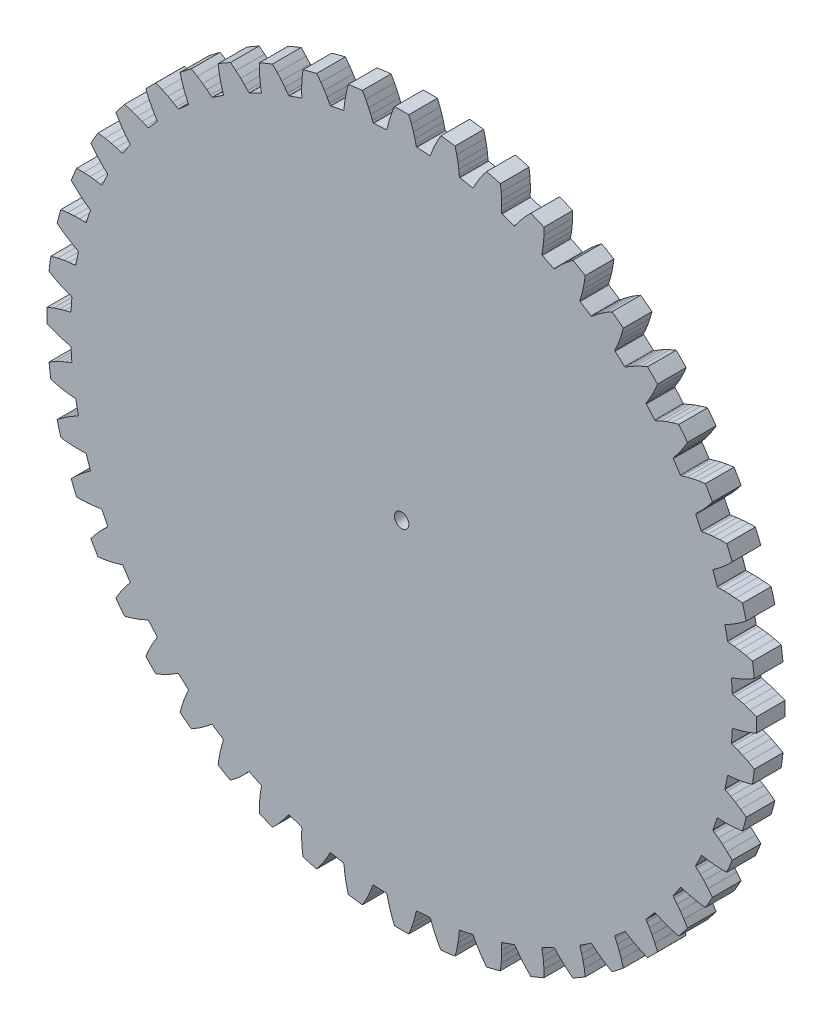
from build123d import *

# Parameters (mm, degrees)
BOSS_EXTRUDE1_DEPTH = 6.35
SKETCH2_R           = 1.5875
CUT_EXTRUDE1_DEPTH  = 112.344514528


with BuildPart() as part:
    # Model → Boss-Extrude1 (new body)
    with BuildSketch(Plane.XY):
        with BuildLine():
            ThreePointArc((73.162446932, -4.79532012), (73.204630323, -4.10132118), (73.240230779, -3.406953428))
            ThreePointArc((73.240230779, -3.406953428), (73.260031427, -3.342420246), (73.308462453, -3.295398625))
            ThreePointArc((73.308462453, -3.295398625), (73.487533932, -3.211262438), (73.677741354, -3.156795666))
            ThreePointArc((73.677741354, -3.156795666), (74.184998964, -3.047419574), (74.689081629, -2.92423646))
            ThreePointArc((74.689081629, -2.92423646), (75.251182782, -2.771398985), (75.809400918, -2.604937236))
            ThreePointArc((75.809400918, -2.604937236), (76.484121563, -2.384761597), (77.152671556, -2.14650508))
            ThreePointArc((77.152671556, -2.14650508), (77.874182007, -1.868186231), (78.588597242, -1.572129509))
            ThreePointArc((78.588597242, -1.572129509), (78.604320541, 0), (78.588597242, 1.572129509))
            ThreePointArc((78.588597242, 1.572129509), (77.874182033, 1.868186221), (77.152671609, 2.14650506))
            ThreePointArc((77.152671609, 2.14650506), (76.484121638, 2.384761571), (75.809401016, 2.604937206))
            ThreePointArc((75.809401016, 2.604937206), (75.251182893, 2.771398953), (74.689081753, 2.924236429))
            ThreePointArc((74.689081753, 2.924236429), (74.184999097, 3.047419543), (73.677741495, 3.156795638))
            ThreePointArc((73.677741495, 3.156795638), (73.48753402, 3.211262408), (73.308462484, 3.295398596))
            ThreePointArc((73.308462484, 3.295398596), (73.260031444, 3.342420218), (73.24023078, 3.406953405))
            ThreePointArc((73.24023078, 3.406953405), (73.162446933, 4.795320109), (73.058347109, 6.181961972))
            ThreePointArc((73.058347109, 6.181961972), (73.06955509, 6.248527566), (73.111434229, 6.301468429))
            ThreePointArc((73.111434229, 6.301468429), (73.277991751, 6.408258337), (73.459462581, 6.487086188))
            ThreePointArc((73.459462581, 6.487086188), (73.948104087, 6.661736958), (74.431795632, 6.849662213))
            ThreePointArc((74.431795632, 6.849662213), (74.969138639, 7.074561066), (75.500853523, 7.312460799))
            ThreePointArc((75.500853523, 7.312460799), (76.141063151, 7.618821522), (76.77279489, 7.942303006))
            ThreePointArc((76.77279489, 7.942303006), (77.451804819, 8.312416811), (78.121464977, 8.699190627))
            ThreePointArc((78.121464977, 8.699190627), (77.931849682, 10.259922652), (77.71105682, 11.816550073))
            ThreePointArc((77.71105682, 11.816550073), (76.964110376, 12.016824081), (76.212444676, 12.198585857))
            ThreePointArc((76.212444676, 12.198585857), (75.518515528, 12.347540768), (74.820828547, 12.477764056))
            ThreePointArc((74.820828547, 12.477764056), (74.245658439, 12.569939614), (73.668416858, 12.648100622))
            ThreePointArc((73.668416858, 12.648100622), (73.152568076, 12.704433898), (72.635373689, 12.746663862))
            ThreePointArc((72.635373689, 12.746663862), (72.439684125, 12.775837604), (72.251162595, 12.83588047))
            ThreePointArc((72.251162595, 12.83588047), (72.197008335, 12.876178295), (72.168953797, 12.937574888))
            ThreePointArc((72.168953797, 12.937574888), (71.910617183, 14.303911092), (71.626414865, 15.665102288))
            ThreePointArc((71.626414865, 15.665102288), (71.628838407, 15.73256134), (71.663449094, 15.790515611))
            ThreePointArc((71.663449094, 15.790515611), (71.814642814, 15.918132035), (71.984272037, 16.0199722))
            ThreePointArc((71.984272037, 16.0199722), (72.445936647, 16.256909323), (72.900960975, 16.506361267))
            ThreePointArc((72.900960975, 16.506361267), (73.404351747, 16.799473416), (73.900465591, 17.104740603))
            ThreePointArc((73.900465591, 17.104740603), (74.495210038, 17.492044493), (75.079314418, 17.895216086))
            ThreePointArc((75.079314418, 17.895216086), (75.704205778, 18.350792096), (76.317652787, 18.821665199))
            ThreePointArc((76.317652787, 18.821665199), (75.925943269, 20.344295183), (75.50385867, 21.858786189))
            ThreePointArc((75.50385867, 21.858786189), (74.737161453, 21.959850751), (73.968201684, 22.041945467))
            ThreePointArc((73.968201684, 22.041945467), (73.260766679, 22.099050119), (72.552050957, 22.137092904))
            ThreePointArc((72.552050957, 22.137092904), (71.969770185, 22.153405123), (71.387264927, 22.155552307))
            ThreePointArc((71.387264927, 22.155552307), (70.868476334, 22.144071867), (70.350194501, 22.118433134))
            ThreePointArc((70.350194501, 22.118433134), (70.15237115, 22.121814677), (69.957625281, 22.15673687))
            ThreePointArc((69.957625281, 22.15673687), (69.898674397, 22.189621393), (69.862846006, 22.246830877))
            ThreePointArc((69.862846006, 22.246830877), (69.428376836, 23.567758191), (68.968934805, 24.880208361))
            ThreePointArc((68.968934805, 24.880208361), (68.962532439, 24.947406627), (68.989282477, 25.009382692))
            ThreePointArc((68.989282477, 25.009382692), (69.122525427, 25.155642081), (69.27741064, 25.278752046))
            ThreePointArc((69.27741064, 25.278752046), (69.704199144, 25.573921462), (70.122770665, 25.880631904))
            ThreePointArc((70.122770665, 25.880631904), (70.583596046, 26.236942118), (71.035620203, 26.604353553))
            ThreePointArc((71.035620203, 26.604353553), (71.574723228, 27.065973732), (72.101206061, 27.541937057))
            ThreePointArc((72.101206061, 27.541937057), (72.661286786, 28.075180241), (73.208024398, 28.622095861))
            ThreePointArc((73.208024398, 28.622095861), (72.620922915, 30.080571183), (72.004768564, 31.527012414))
            ThreePointArc((72.004768564, 31.527012414), (71.231438976, 31.527138285), (70.458342254, 31.508161279))
            ThreePointArc((70.458342254, 31.508161279), (69.7495058, 31.472438595), (69.04188766, 31.417649954))
            ThreePointArc((69.04188766, 31.417649954), (68.462459208, 31.357819728), (67.8846571, 31.28391635))
            ThreePointArc((67.8846571, 31.28391635), (67.371805314, 31.204818627), (66.861303979, 31.111749883))
            ThreePointArc((66.861303979, 31.111749883), (66.664731655, 31.089281367), (66.467093604, 31.098485359))
            ThreePointArc((66.467093604, 31.098485359), (66.404354761, 31.123393916), (66.361365551, 31.175437421))
            ThreePointArc((66.361365551, 31.175437421), (65.758197711, 32.428354413), (65.131377147, 33.669607171))
            ThreePointArc((65.131377147, 33.669607171), (65.116258421, 33.73539487), (65.134690109, 33.800332302))
            ThreePointArc((65.134690109, 33.800332302), (65.247702466, 33.962732117), (65.385193539, 34.105005435))
            ThreePointArc((65.385193539, 34.105005435), (65.769803469, 34.453356715), (66.144760306, 34.812077753))
            ThreePointArc((66.144760306, 34.812077753), (66.555135447, 35.225489466), (66.955335659, 35.648758637))
            ThreePointArc((66.955335659, 35.648758637), (67.429573058, 36.176796657), (67.889426077, 36.717407849))
            ThreePointArc((67.889426077, 36.717407849), (68.375113032, 37.319194268), (68.845786414, 37.932794528))
            ThreePointArc((68.845786414, 37.932794528), (68.073338436, 39.302160271), (67.273656905, 40.655802714))
            ThreePointArc((67.273656905, 40.655802714), (66.506926829, 40.554987742), (65.742921053, 40.435263716))
            ThreePointArc((65.742921053, 40.435263716), (65.044811539, 40.307324922), (64.350398523, 40.160642303))
            ThreePointArc((64.350398523, 40.160642303), (63.783736574, 40.025693344), (63.220523969, 39.87700391))
            ThreePointArc((63.220523969, 39.87700391), (62.722384026, 39.731642289), (62.22839801, 39.572735965))
            ThreePointArc((62.22839801, 39.572735965), (62.036440119, 39.524801833), (61.839291526, 39.508130142))
            ThreePointArc((61.839291526, 39.508130142), (61.773838203, 39.52463654), (61.724423732, 39.570623588))
            ThreePointArc((61.724423732, 39.570623588), (60.962877593, 40.7340925), (60.179403569, 41.882909668))
            ThreePointArc((60.179403569, 41.882909668), (60.155827168, 41.946161154), (60.165625135, 42.012948855))
            ThreePointArc((60.165625135, 42.012948855), (60.256473226, 42.188710389), (60.37421765, 42.347712726))
            ThreePointArc((60.37421765, 42.347712726), (60.710068222, 42.743285482), (61.03499476, 43.1478793))
            ThreePointArc((61.03499476, 43.1478793), (61.387898028, 43.611318923), (61.729426758, 44.083203578))
            ThreePointArc((61.729426758, 44.083203578), (62.130684199, 44.668624561), (62.516039191, 45.264633613))
            ThreePointArc((62.516039191, 45.264633613), (62.919022137, 45.924666535), (63.305577938, 46.594452564))
            ThreePointArc((63.305577938, 46.594452564), (62.361000263, 47.851278499), (61.391474324, 49.088960959))
            ThreePointArc((61.391474324, 49.088960959), (60.644462725, 48.888930115), (59.902620245, 48.67050758))
            ThreePointArc((59.902620245, 48.67050758), (59.227182519, 48.452541743), (58.557856226, 48.216474928))
            ThreePointArc((58.557856226, 48.216474928), (58.013656522, 48.008716249), (57.474670145, 47.787784878))
            ThreePointArc((57.474670145, 47.787784878), (56.999765357, 47.578646535), (56.530746897, 47.356621563))
            ThreePointArc((56.530746897, 47.356621563), (56.346687892, 47.284041982), (56.153402025, 47.241779864))
            ThreePointArc((56.153402025, 47.241779864), (56.086354148, 47.249601675), (56.031359909, 47.288745415))
            ThreePointArc((56.031359909, 47.288745415), (55.124465736, 48.342858971), (54.197743711, 49.379583967))
            ThreePointArc((54.197743711, 49.379583967), (54.166113034, 49.43921699), (54.167109633, 49.506712205))
            ThreePointArc((54.167109633, 49.506712205), (54.234239023, 49.69282813), (54.330222157, 49.865838912))
            ThreePointArc((54.330222157, 49.865838912), (54.611566875, 50.301864784), (54.880903531, 50.745408669))
            ThreePointArc((54.880903531, 50.745408669), (55.170296653, 51.250946622), (55.447310251, 51.763372683))
            ThreePointArc((55.447310251, 51.763372683), (55.768722107, 52.396159914), (56.072985542, 53.037368946))
            ThreePointArc((56.072985542, 53.037368946), (56.386369329, 53.744355024), (56.682193471, 54.458866597))
            ThreePointArc((56.682193471, 54.458866597), (55.581648085, 55.581648085), (54.458866597, 56.682193471))
            ThreePointArc((54.458866597, 56.682193471), (53.74435505, 56.38636934), (53.037368997, 56.072985565))
            ThreePointArc((53.037368997, 56.072985565), (52.396159985, 55.768722142), (51.763372773, 55.447310299))
            ThreePointArc((51.763372773, 55.447310299), (51.250946723, 55.170296709), (50.74540878, 54.880903596))
            ThreePointArc((50.74540878, 54.880903596), (50.3018649, 54.611566948), (49.865839032, 54.330222236))
            ThreePointArc((49.865839032, 54.330222236), (49.692828213, 54.234239063), (49.506712247, 54.167109635))
            ThreePointArc((49.506712247, 54.167109635), (49.439217022, 54.166113025), (49.379583984, 54.197743696))
            ThreePointArc((49.379583984, 54.197743696), (48.342858988, 55.124465721), (47.288745432, 56.031359895))
            ThreePointArc((47.288745432, 56.031359895), (47.249601688, 56.086354117), (47.241779868, 56.153401983))
            ThreePointArc((47.241779868, 56.153401983), (47.284041953, 56.346687804), (47.3566215, 56.530746768))
            ThreePointArc((47.3566215, 56.530746768), (47.578646478, 56.999765233), (47.787784827, 57.474670027))
            ThreePointArc((47.787784827, 57.474670027), (48.008716207, 58.013656415), (48.216474893, 58.55785613))
            ThreePointArc((48.216474893, 58.55785613), (48.452541718, 59.227182444), (48.670507563, 59.902620192))
            ThreePointArc((48.670507563, 59.902620192), (48.888930108, 60.644462698), (49.088960959, 61.391474324))
            ThreePointArc((49.088960959, 61.391474324), (47.851278499, 62.361000263), (46.594452564, 63.305577938))
            ThreePointArc((46.594452564, 63.305577938), (45.924666559, 62.919022151), (45.264633661, 62.516039221))
            ThreePointArc((45.264633661, 62.516039221), (44.668624627, 62.130684243), (44.083203661, 61.729426817))
            ThreePointArc((44.083203661, 61.729426817), (43.611319016, 61.387898096), (43.147879401, 61.034994839))
            ThreePointArc((43.147879401, 61.034994839), (42.743285587, 60.710068309), (42.347712835, 60.374217744))
            ThreePointArc((42.347712835, 60.374217744), (42.188710466, 60.256473277), (42.012948897, 60.165625142))
            ThreePointArc((42.012948897, 60.165625142), (41.946161187, 60.155827164), (41.882909686, 60.179403556))
            ThreePointArc((41.882909686, 60.179403556), (40.734092519, 60.96287758), (39.570623607, 61.72442372))
            ThreePointArc((39.570623607, 61.72442372), (39.524636557, 61.773838175), (39.508130151, 61.839291485))
            ThreePointArc((39.508130151, 61.839291485), (39.524801816, 62.036440028), (39.572735919, 62.228397873))
            ThreePointArc((39.572735919, 62.228397873), (39.731642249, 62.722383896), (39.877003876, 63.220523846))
            ThreePointArc((39.877003876, 63.220523846), (40.025693316, 63.783736462), (40.160642281, 64.350398423))
            ThreePointArc((40.160642281, 64.350398423), (40.307324906, 65.044811462), (40.435263707, 65.742920997))
            ThreePointArc((40.435263707, 65.742920997), (40.554987738, 66.506926801), (40.655802714, 67.273656905))
            ThreePointArc((40.655802714, 67.273656905), (39.302160271, 68.073338436), (37.932794528, 68.845786414))
            ThreePointArc((37.932794528, 68.845786414), (37.31919429, 68.375113049), (36.717407893, 67.889426113))
            ThreePointArc((36.717407893, 67.889426113), (36.176796717, 67.42957311), (35.648758713, 66.955335728))
            ThreePointArc((35.648758713, 66.955335728), (35.225489549, 66.555135527), (34.812077843, 66.144760398))
            ThreePointArc((34.812077843, 66.144760398), (34.453356808, 65.769803569), (34.105005531, 65.385193648))
            ThreePointArc((34.105005531, 65.385193648), (33.962732186, 65.247702526), (33.800332343, 65.134690122))
            ThreePointArc((33.800332343, 65.134690122), (33.735394903, 65.116258421), (33.669607191, 65.131377137))
            ThreePointArc((33.669607191, 65.131377137), (32.428354433, 65.758197701), (31.175437442, 66.361365541))
            ThreePointArc((31.175437442, 66.361365541), (31.123393936, 66.404354734), (31.098485374, 66.467093564))
            ThreePointArc((31.098485374, 66.467093564), (31.089281362, 66.664731563), (31.111749855, 66.861303838))
            ThreePointArc((31.111749855, 66.861303838), (31.204818605, 67.37180518), (31.283916332, 67.884656973))
            ThreePointArc((31.283916332, 67.884656973), (31.357819715, 68.462459094), (31.417649945, 69.041887558))
            ThreePointArc((31.417649945, 69.041887558), (31.47243859, 69.749505721), (31.508161277, 70.458342198))
            ThreePointArc((31.508161277, 70.458342198), (31.527138285, 71.231438948), (31.527012414, 72.004768564))
            ThreePointArc((31.527012414, 72.004768564), (30.080571183, 72.620922915), (28.622095861, 73.208024398))
            ThreePointArc((28.622095861, 73.208024398), (28.075180261, 72.661286806), (27.541937096, 72.101206102))
            ThreePointArc((27.541937096, 72.101206102), (27.065973785, 71.574723287), (26.604353618, 71.035620282))
            ThreePointArc((26.604353618, 71.035620282), (26.23694219, 70.583596136), (25.880631981, 70.122770767))
            ThreePointArc((25.880631981, 70.122770767), (25.573921542, 69.704199255), (25.278752126, 69.277410759))
            ThreePointArc((25.278752126, 69.277410759), (25.155642143, 69.122525496), (25.009382731, 68.989282495))
            ThreePointArc((25.009382731, 68.989282495), (24.94740666, 68.962532443), (24.880208383, 68.968934797))
            ThreePointArc((24.880208383, 68.968934797), (23.567758212, 69.428376828), (22.246830898, 69.862846))
            ThreePointArc((22.246830898, 69.862846), (22.189621416, 69.898674374), (22.156736889, 69.957625244))
            ThreePointArc((22.156736889, 69.957625244), (22.121814683, 70.152371058), (22.118433125, 70.350194357))
            ThreePointArc((22.118433125, 70.350194357), (22.144071862, 70.868476198), (22.155552306, 71.387264799))
            ThreePointArc((22.155552306, 71.387264799), (22.153405125, 71.96977007), (22.137092908, 72.552050855))
            ThreePointArc((22.137092908, 72.552050855), (22.099050124, 73.2607666), (22.041945472, 73.968201628))
            ThreePointArc((22.041945472, 73.968201628), (21.959850754, 74.737161425), (21.858786189, 75.50385867))
            ThreePointArc((21.858786189, 75.50385867), (20.344295183, 75.925943269), (18.821665199, 76.317652787))
            ThreePointArc((18.821665199, 76.317652787), (18.350792113, 75.7042058), (17.895216119, 75.079314464))
            ThreePointArc((17.895216119, 75.079314464), (17.492044537, 74.495210104), (17.104740658, 73.900465677))
            ThreePointArc((17.104740658, 73.900465677), (16.799473475, 73.404351846), (16.50636133, 72.900961087))
            ThreePointArc((16.50636133, 72.900961087), (16.256909387, 72.445936767), (16.019972264, 71.984272166))
            ThreePointArc((16.019972264, 71.984272166), (15.918132087, 71.81464289), (15.790515647, 71.663449117))
            ThreePointArc((15.790515647, 71.663449117), (15.732561372, 71.628838415), (15.66510231, 71.626414861))
            ThreePointArc((15.66510231, 71.626414861), (14.303911114, 71.910617179), (12.93757491, 72.168953793))
            ThreePointArc((12.93757491, 72.168953793), (12.876178322, 72.197008315), (12.835880494, 72.25116256))
            ThreePointArc((12.835880494, 72.25116256), (12.775837623, 72.439684034), (12.746663872, 72.635373545))
            ThreePointArc((12.746663872, 72.635373545), (12.704433911, 73.152567941), (12.648100638, 73.668416731))
            ThreePointArc((12.648100638, 73.668416731), (12.569939631, 74.245658325), (12.477764073, 74.820828446))
            ThreePointArc((12.477764073, 74.820828446), (12.347540784, 75.51851545), (12.198585869, 76.212444621))
            ThreePointArc((12.198585869, 76.212444621), (12.016824088, 76.964110349), (11.816550073, 77.71105682))
            ThreePointArc((11.816550073, 77.71105682), (10.259922652, 77.931849682), (8.699190627, 78.121464977))
            ThreePointArc((8.699190627, 78.121464977), (8.312416824, 77.451804844), (7.942303033, 76.77279494))
            ThreePointArc((7.942303033, 76.77279494), (7.618821558, 76.141063222), (7.312460842, 75.500853616))
            ThreePointArc((7.312460842, 75.500853616), (7.074561112, 74.969138744), (6.849662261, 74.431795751))
            ThreePointArc((6.849662261, 74.431795751), (6.661737006, 73.948104214), (6.487086235, 73.459462718))
            ThreePointArc((6.487086235, 73.459462718), (6.408258378, 73.277991833), (6.301468462, 73.111434256))
            ThreePointArc((6.301468462, 73.111434256), (6.248527597, 73.069555103), (6.181961994, 73.058347108))
            ThreePointArc((6.181961994, 73.058347108), (4.795320131, 73.162446932), (3.406953428, 73.240230779))
            ThreePointArc((3.406953428, 73.240230779), (3.342420246, 73.260031427), (3.295398625, 73.308462453))
            ThreePointArc((3.295398625, 73.308462453), (3.211262438, 73.487533932), (3.156795666, 73.677741354))
            ThreePointArc((3.156795666, 73.677741354), (3.047419574, 74.184998964), (2.92423646, 74.689081629))
            ThreePointArc((2.92423646, 74.689081629), (2.771398985, 75.251182782), (2.604937236, 75.809400918))
            ThreePointArc((2.604937236, 75.809400918), (2.384761597, 76.484121563), (2.14650508, 77.152671556))
            ThreePointArc((2.14650508, 77.152671556), (1.868186231, 77.874182007), (1.572129509, 78.588597242))
            ThreePointArc((1.572129509, 78.588597242), (0, 78.604320541), (-1.572129509, 78.588597242))
            ThreePointArc((-1.572129509, 78.588597242), (-1.868186221, 77.874182033), (-2.14650506, 77.152671609))
            ThreePointArc((-2.14650506, 77.152671609), (-2.384761571, 76.484121638), (-2.604937206, 75.809401016))
            ThreePointArc((-2.604937206, 75.809401016), (-2.771398953, 75.251182893), (-2.924236429, 74.689081753))
            ThreePointArc((-2.924236429, 74.689081753), (-3.047419543, 74.184999097), (-3.156795638, 73.677741495))
            ThreePointArc((-3.156795638, 73.677741495), (-3.211262408, 73.48753402), (-3.295398596, 73.308462484))
            ThreePointArc((-3.295398596, 73.308462484), (-3.342420218, 73.260031444), (-3.406953405, 73.24023078))
            ThreePointArc((-3.406953405, 73.24023078), (-4.795320109, 73.162446933), (-6.181961972, 73.058347109))
            ThreePointArc((-6.181961972, 73.058347109), (-6.248527566, 73.06955509), (-6.301468429, 73.111434229))
            ThreePointArc((-6.301468429, 73.111434229), (-6.408258337, 73.277991751), (-6.487086188, 73.459462581))
            ThreePointArc((-6.487086188, 73.459462581), (-6.661736958, 73.948104087), (-6.849662213, 74.431795632))
            ThreePointArc((-6.849662213, 74.431795632), (-7.074561066, 74.969138639), (-7.312460799, 75.500853523))
            ThreePointArc((-7.312460799, 75.500853523), (-7.618821522, 76.141063151), (-7.942303006, 76.77279489))
            ThreePointArc((-7.942303006, 76.77279489), (-8.312416811, 77.451804819), (-8.699190627, 78.121464977))
            ThreePointArc((-8.699190627, 78.121464977), (-10.259922652, 77.931849682), (-11.816550073, 77.71105682))
            ThreePointArc((-11.816550073, 77.71105682), (-12.016824081, 76.964110376), (-12.198585857, 76.212444676))
            ThreePointArc((-12.198585857, 76.212444676), (-12.347540768, 75.518515528), (-12.477764056, 74.820828547))
            ThreePointArc((-12.477764056, 74.820828547), (-12.569939614, 74.245658439), (-12.648100622, 73.668416858))
            ThreePointArc((-12.648100622, 73.668416858), (-12.704433898, 73.152568076), (-12.746663862, 72.635373689))
            ThreePointArc((-12.746663862, 72.635373689), (-12.775837604, 72.439684125), (-12.83588047, 72.251162595))
            ThreePointArc((-12.83588047, 72.251162595), (-12.876178295, 72.197008335), (-12.937574888, 72.168953797))
            ThreePointArc((-12.937574888, 72.168953797), (-14.303911092, 71.910617183), (-15.665102288, 71.626414865))
            ThreePointArc((-15.665102288, 71.626414865), (-15.73256134, 71.628838407), (-15.790515611, 71.663449094))
            ThreePointArc((-15.790515611, 71.663449094), (-15.918132035, 71.814642814), (-16.0199722, 71.984272037))
            ThreePointArc((-16.0199722, 71.984272037), (-16.256909323, 72.445936647), (-16.506361267, 72.900960975))
            ThreePointArc((-16.506361267, 72.900960975), (-16.799473416, 73.404351747), (-17.104740603, 73.900465591))
            ThreePointArc((-17.104740603, 73.900465591), (-17.492044493, 74.495210038), (-17.895216086, 75.079314418))
            ThreePointArc((-17.895216086, 75.079314418), (-18.350792096, 75.704205778), (-18.821665199, 76.317652787))
            ThreePointArc((-18.821665199, 76.317652787), (-20.344295183, 75.925943269), (-21.858786189, 75.50385867))
            ThreePointArc((-21.858786189, 75.50385867), (-21.959850751, 74.737161453), (-22.041945467, 73.968201684))
            ThreePointArc((-22.041945467, 73.968201684), (-22.099050119, 73.260766679), (-22.137092904, 72.552050957))
            ThreePointArc((-22.137092904, 72.552050957), (-22.153405123, 71.969770185), (-22.155552307, 71.387264927))
            ThreePointArc((-22.155552307, 71.387264927), (-22.144071867, 70.868476334), (-22.118433134, 70.350194501))
            ThreePointArc((-22.118433134, 70.350194501), (-22.121814677, 70.15237115), (-22.15673687, 69.957625281))
            ThreePointArc((-22.15673687, 69.957625281), (-22.189621393, 69.898674397), (-22.246830877, 69.862846006))
            ThreePointArc((-22.246830877, 69.862846006), (-23.567758191, 69.428376836), (-24.880208361, 68.968934805))
            ThreePointArc((-24.880208361, 68.968934805), (-24.947406627, 68.962532439), (-25.009382692, 68.989282477))
            ThreePointArc((-25.009382692, 68.989282477), (-25.155642081, 69.122525427), (-25.278752046, 69.27741064))
            ThreePointArc((-25.278752046, 69.27741064), (-25.573921462, 69.704199144), (-25.880631904, 70.122770665))
            ThreePointArc((-25.880631904, 70.122770665), (-26.236942118, 70.583596046), (-26.604353553, 71.035620203))
            ThreePointArc((-26.604353553, 71.035620203), (-27.065973732, 71.574723228), (-27.541937057, 72.101206061))
            ThreePointArc((-27.541937057, 72.101206061), (-28.075180241, 72.661286786), (-28.622095861, 73.208024398))
            ThreePointArc((-28.622095861, 73.208024398), (-30.080571183, 72.620922915), (-31.527012414, 72.004768564))
            ThreePointArc((-31.527012414, 72.004768564), (-31.527138285, 71.231438976), (-31.508161279, 70.458342254))
            ThreePointArc((-31.508161279, 70.458342254), (-31.472438595, 69.7495058), (-31.417649954, 69.04188766))
            ThreePointArc((-31.417649954, 69.04188766), (-31.357819728, 68.462459208), (-31.28391635, 67.8846571))
            ThreePointArc((-31.28391635, 67.8846571), (-31.204818627, 67.371805314), (-31.111749883, 66.861303979))
            ThreePointArc((-31.111749883, 66.861303979), (-31.089281367, 66.664731655), (-31.098485359, 66.467093604))
            ThreePointArc((-31.098485359, 66.467093604), (-31.123393916, 66.404354761), (-31.175437421, 66.361365551))
            ThreePointArc((-31.175437421, 66.361365551), (-32.428354413, 65.758197711), (-33.669607171, 65.131377147))
            ThreePointArc((-33.669607171, 65.131377147), (-33.73539487, 65.116258421), (-33.800332302, 65.134690109))
            ThreePointArc((-33.800332302, 65.134690109), (-33.962732117, 65.247702466), (-34.105005435, 65.385193539))
            ThreePointArc((-34.105005435, 65.385193539), (-34.453356715, 65.769803469), (-34.812077753, 66.144760306))
            ThreePointArc((-34.812077753, 66.144760306), (-35.225489466, 66.555135447), (-35.648758637, 66.955335659))
            ThreePointArc((-35.648758637, 66.955335659), (-36.176796657, 67.429573058), (-36.717407849, 67.889426077))
            ThreePointArc((-36.717407849, 67.889426077), (-37.319194268, 68.375113032), (-37.932794528, 68.845786414))
            ThreePointArc((-37.932794528, 68.845786414), (-39.302160271, 68.073338436), (-40.655802714, 67.273656905))
            ThreePointArc((-40.655802714, 67.273656905), (-40.554987742, 66.506926829), (-40.435263716, 65.742921053))
            ThreePointArc((-40.435263716, 65.742921053), (-40.307324922, 65.044811539), (-40.160642303, 64.350398523))
            ThreePointArc((-40.160642303, 64.350398523), (-40.025693344, 63.783736574), (-39.87700391, 63.220523969))
            ThreePointArc((-39.87700391, 63.220523969), (-39.731642289, 62.722384026), (-39.572735965, 62.22839801))
            ThreePointArc((-39.572735965, 62.22839801), (-39.524801833, 62.036440119), (-39.508130142, 61.839291526))
            ThreePointArc((-39.508130142, 61.839291526), (-39.52463654, 61.773838203), (-39.570623588, 61.724423732))
            ThreePointArc((-39.570623588, 61.724423732), (-40.7340925, 60.962877593), (-41.882909668, 60.179403569))
            ThreePointArc((-41.882909668, 60.179403569), (-41.946161154, 60.155827168), (-42.012948855, 60.165625135))
            ThreePointArc((-42.012948855, 60.165625135), (-42.188710389, 60.256473226), (-42.347712726, 60.37421765))
            ThreePointArc((-42.347712726, 60.37421765), (-42.743285482, 60.710068222), (-43.1478793, 61.03499476))
            ThreePointArc((-43.1478793, 61.03499476), (-43.611318923, 61.387898028), (-44.083203578, 61.729426758))
            ThreePointArc((-44.083203578, 61.729426758), (-44.668624561, 62.130684199), (-45.264633613, 62.516039191))
            ThreePointArc((-45.264633613, 62.516039191), (-45.924666535, 62.919022137), (-46.594452564, 63.305577938))
            ThreePointArc((-46.594452564, 63.305577938), (-47.851278499, 62.361000263), (-49.088960959, 61.391474324))
            ThreePointArc((-49.088960959, 61.391474324), (-48.888930115, 60.644462725), (-48.67050758, 59.902620245))
            ThreePointArc((-48.67050758, 59.902620245), (-48.452541743, 59.227182519), (-48.216474928, 58.557856226))
            ThreePointArc((-48.216474928, 58.557856226), (-48.008716249, 58.013656522), (-47.787784878, 57.474670145))
            ThreePointArc((-47.787784878, 57.474670145), (-47.578646535, 56.999765357), (-47.356621563, 56.530746897))
            ThreePointArc((-47.356621563, 56.530746897), (-47.284041982, 56.346687892), (-47.241779864, 56.153402025))
            ThreePointArc((-47.241779864, 56.153402025), (-47.249601675, 56.086354148), (-47.288745415, 56.031359909))
            ThreePointArc((-47.288745415, 56.031359909), (-48.342858971, 55.124465736), (-49.379583967, 54.197743711))
            ThreePointArc((-49.379583967, 54.197743711), (-49.43921699, 54.166113034), (-49.506712205, 54.167109633))
            ThreePointArc((-49.506712205, 54.167109633), (-49.69282813, 54.234239023), (-49.865838912, 54.330222157))
            ThreePointArc((-49.865838912, 54.330222157), (-50.301864784, 54.611566875), (-50.745408669, 54.880903531))
            ThreePointArc((-50.745408669, 54.880903531), (-51.250946622, 55.170296653), (-51.763372683, 55.447310251))
            ThreePointArc((-51.763372683, 55.447310251), (-52.396159914, 55.768722107), (-53.037368946, 56.072985542))
            ThreePointArc((-53.037368946, 56.072985542), (-53.744355024, 56.386369329), (-54.458866597, 56.682193471))
            ThreePointArc((-54.458866597, 56.682193471), (-55.581648085, 55.581648085), (-56.682193471, 54.458866597))
            ThreePointArc((-56.682193471, 54.458866597), (-56.38636934, 53.74435505), (-56.072985565, 53.037368997))
            ThreePointArc((-56.072985565, 53.037368997), (-55.768722142, 52.396159985), (-55.447310299, 51.763372773))
            ThreePointArc((-55.447310299, 51.763372773), (-55.170296709, 51.250946723), (-54.880903596, 50.74540878))
            ThreePointArc((-54.880903596, 50.74540878), (-54.611566948, 50.3018649), (-54.330222236, 49.865839032))
            ThreePointArc((-54.330222236, 49.865839032), (-54.234239063, 49.692828213), (-54.167109635, 49.506712247))
            ThreePointArc((-54.167109635, 49.506712247), (-54.166113025, 49.439217022), (-54.197743696, 49.379583984))
            ThreePointArc((-54.197743696, 49.379583984), (-55.124465721, 48.342858988), (-56.031359895, 47.288745432))
            ThreePointArc((-56.031359895, 47.288745432), (-56.086354117, 47.249601688), (-56.153401983, 47.241779868))
            ThreePointArc((-56.153401983, 47.241779868), (-56.346687804, 47.284041953), (-56.530746768, 47.3566215))
            ThreePointArc((-56.530746768, 47.3566215), (-56.999765233, 47.578646478), (-57.474670027, 47.787784827))
            ThreePointArc((-57.474670027, 47.787784827), (-58.013656415, 48.008716207), (-58.55785613, 48.216474893))
            ThreePointArc((-58.55785613, 48.216474893), (-59.227182444, 48.452541718), (-59.902620192, 48.670507563))
            ThreePointArc((-59.902620192, 48.670507563), (-60.644462698, 48.888930108), (-61.391474324, 49.088960959))
            ThreePointArc((-61.391474324, 49.088960959), (-62.361000263, 47.851278499), (-63.305577938, 46.594452564))
            ThreePointArc((-63.305577938, 46.594452564), (-62.919022151, 45.924666559), (-62.516039221, 45.264633661))
            ThreePointArc((-62.516039221, 45.264633661), (-62.130684243, 44.668624627), (-61.729426817, 44.083203661))
            ThreePointArc((-61.729426817, 44.083203661), (-61.387898096, 43.611319016), (-61.034994839, 43.147879401))
            ThreePointArc((-61.034994839, 43.147879401), (-60.710068309, 42.743285587), (-60.374217744, 42.347712835))
            ThreePointArc((-60.374217744, 42.347712835), (-60.256473277, 42.188710466), (-60.165625142, 42.012948897))
            ThreePointArc((-60.165625142, 42.012948897), (-60.155827164, 41.946161187), (-60.179403556, 41.882909686))
            ThreePointArc((-60.179403556, 41.882909686), (-60.96287758, 40.734092519), (-61.72442372, 39.570623607))
            ThreePointArc((-61.72442372, 39.570623607), (-61.773838175, 39.524636557), (-61.839291485, 39.508130151))
            ThreePointArc((-61.839291485, 39.508130151), (-62.036440028, 39.524801816), (-62.228397873, 39.572735919))
            ThreePointArc((-62.228397873, 39.572735919), (-62.722383896, 39.731642249), (-63.220523846, 39.877003876))
            ThreePointArc((-63.220523846, 39.877003876), (-63.783736462, 40.025693316), (-64.350398423, 40.160642281))
            ThreePointArc((-64.350398423, 40.160642281), (-65.044811462, 40.307324906), (-65.742920997, 40.435263707))
            ThreePointArc((-65.742920997, 40.435263707), (-66.506926801, 40.554987738), (-67.273656905, 40.655802714))
            ThreePointArc((-67.273656905, 40.655802714), (-68.073338436, 39.302160271), (-68.845786414, 37.932794528))
            ThreePointArc((-68.845786414, 37.932794528), (-68.375113049, 37.31919429), (-67.889426113, 36.717407893))
            ThreePointArc((-67.889426113, 36.717407893), (-67.42957311, 36.176796717), (-66.955335728, 35.648758713))
            ThreePointArc((-66.955335728, 35.648758713), (-66.555135527, 35.225489549), (-66.144760398, 34.812077843))
            ThreePointArc((-66.144760398, 34.812077843), (-65.769803569, 34.453356808), (-65.385193648, 34.105005531))
            ThreePointArc((-65.385193648, 34.105005531), (-65.247702526, 33.962732186), (-65.134690122, 33.800332343))
            ThreePointArc((-65.134690122, 33.800332343), (-65.116258421, 33.735394903), (-65.131377137, 33.669607191))
            ThreePointArc((-65.131377137, 33.669607191), (-65.758197701, 32.428354433), (-66.361365541, 31.175437442))
            ThreePointArc((-66.361365541, 31.175437442), (-66.404354734, 31.123393936), (-66.467093564, 31.098485374))
            ThreePointArc((-66.467093564, 31.098485374), (-66.664731563, 31.089281362), (-66.861303838, 31.111749855))
            ThreePointArc((-66.861303838, 31.111749855), (-67.37180518, 31.204818605), (-67.884656973, 31.283916332))
            ThreePointArc((-67.884656973, 31.283916332), (-68.462459094, 31.357819715), (-69.041887558, 31.417649945))
            ThreePointArc((-69.041887558, 31.417649945), (-69.749505721, 31.47243859), (-70.458342198, 31.508161277))
            ThreePointArc((-70.458342198, 31.508161277), (-71.231438948, 31.527138285), (-72.004768564, 31.527012414))
            ThreePointArc((-72.004768564, 31.527012414), (-72.620922915, 30.080571183), (-73.208024398, 28.622095861))
            ThreePointArc((-73.208024398, 28.622095861), (-72.661286806, 28.075180261), (-72.101206102, 27.541937096))
            ThreePointArc((-72.101206102, 27.541937096), (-71.574723287, 27.065973785), (-71.035620282, 26.604353618))
            ThreePointArc((-71.035620282, 26.604353618), (-70.583596136, 26.23694219), (-70.122770767, 25.880631981))
            ThreePointArc((-70.122770767, 25.880631981), (-69.704199255, 25.573921542), (-69.277410759, 25.278752126))
            ThreePointArc((-69.277410759, 25.278752126), (-69.122525496, 25.155642143), (-68.989282495, 25.009382731))
            ThreePointArc((-68.989282495, 25.009382731), (-68.962532443, 24.94740666), (-68.968934797, 24.880208383))
            ThreePointArc((-68.968934797, 24.880208383), (-69.428376828, 23.567758212), (-69.862846, 22.246830898))
            ThreePointArc((-69.862846, 22.246830898), (-69.898674374, 22.189621416), (-69.957625244, 22.156736889))
            ThreePointArc((-69.957625244, 22.156736889), (-70.152371058, 22.121814683), (-70.350194357, 22.118433125))
            ThreePointArc((-70.350194357, 22.118433125), (-70.868476198, 22.144071862), (-71.387264799, 22.155552306))
            ThreePointArc((-71.387264799, 22.155552306), (-71.96977007, 22.153405125), (-72.552050855, 22.137092908))
            ThreePointArc((-72.552050855, 22.137092908), (-73.2607666, 22.099050124), (-73.968201628, 22.041945472))
            ThreePointArc((-73.968201628, 22.041945472), (-74.737161425, 21.959850754), (-75.50385867, 21.858786189))
            ThreePointArc((-75.50385867, 21.858786189), (-75.925943269, 20.344295183), (-76.317652787, 18.821665199))
            ThreePointArc((-76.317652787, 18.821665199), (-75.7042058, 18.350792113), (-75.079314464, 17.895216119))
            ThreePointArc((-75.079314464, 17.895216119), (-74.495210104, 17.492044537), (-73.900465677, 17.104740658))
            ThreePointArc((-73.900465677, 17.104740658), (-73.404351846, 16.799473475), (-72.900961087, 16.50636133))
            ThreePointArc((-72.900961087, 16.50636133), (-72.445936767, 16.256909387), (-71.984272166, 16.019972264))
            ThreePointArc((-71.984272166, 16.019972264), (-71.81464289, 15.918132087), (-71.663449117, 15.790515647))
            ThreePointArc((-71.663449117, 15.790515647), (-71.628838415, 15.732561372), (-71.626414861, 15.66510231))
            ThreePointArc((-71.626414861, 15.66510231), (-71.910617179, 14.303911114), (-72.168953793, 12.93757491))
            ThreePointArc((-72.168953793, 12.93757491), (-72.197008315, 12.876178322), (-72.25116256, 12.835880494))
            ThreePointArc((-72.25116256, 12.835880494), (-72.439684034, 12.775837623), (-72.635373545, 12.746663872))
            ThreePointArc((-72.635373545, 12.746663872), (-73.152567941, 12.704433911), (-73.668416731, 12.648100638))
            ThreePointArc((-73.668416731, 12.648100638), (-74.245658325, 12.569939631), (-74.820828446, 12.477764073))
            ThreePointArc((-74.820828446, 12.477764073), (-75.51851545, 12.347540784), (-76.212444621, 12.198585869))
            ThreePointArc((-76.212444621, 12.198585869), (-76.964110349, 12.016824088), (-77.71105682, 11.816550073))
            ThreePointArc((-77.71105682, 11.816550073), (-77.931849682, 10.259922652), (-78.121464977, 8.699190627))
            ThreePointArc((-78.121464977, 8.699190627), (-77.451804844, 8.312416824), (-76.77279494, 7.942303033))
            ThreePointArc((-76.77279494, 7.942303033), (-76.141063222, 7.618821558), (-75.500853616, 7.312460842))
            ThreePointArc((-75.500853616, 7.312460842), (-74.969138744, 7.074561112), (-74.431795751, 6.849662261))
            ThreePointArc((-74.431795751, 6.849662261), (-73.948104214, 6.661737006), (-73.459462718, 6.487086235))
            ThreePointArc((-73.459462718, 6.487086235), (-73.277991833, 6.408258378), (-73.111434256, 6.301468462))
            ThreePointArc((-73.111434256, 6.301468462), (-73.069555103, 6.248527597), (-73.058347108, 6.181961994))
            ThreePointArc((-73.058347108, 6.181961994), (-73.162446932, 4.795320131), (-73.240230779, 3.406953428))
            ThreePointArc((-73.240230779, 3.406953428), (-73.260031427, 3.342420246), (-73.308462453, 3.295398625))
            ThreePointArc((-73.308462453, 3.295398625), (-73.487533932, 3.211262438), (-73.677741354, 3.156795666))
            ThreePointArc((-73.677741354, 3.156795666), (-74.184998964, 3.047419574), (-74.689081629, 2.92423646))
            ThreePointArc((-74.689081629, 2.92423646), (-75.251182782, 2.771398985), (-75.809400918, 2.604937236))
            ThreePointArc((-75.809400918, 2.604937236), (-76.484121563, 2.384761597), (-77.152671556, 2.14650508))
            ThreePointArc((-77.152671556, 2.14650508), (-77.874182007, 1.868186231), (-78.588597242, 1.572129509))
            ThreePointArc((-78.588597242, 1.572129509), (-78.604320541, 0), (-78.588597242, -1.572129509))
            ThreePointArc((-78.588597242, -1.572129509), (-77.874182033, -1.868186221), (-77.152671609, -2.14650506))
            ThreePointArc((-77.152671609, -2.14650506), (-76.484121638, -2.384761571), (-75.809401016, -2.604937206))
            ThreePointArc((-75.809401016, -2.604937206), (-75.251182893, -2.771398953), (-74.689081753, -2.924236429))
            ThreePointArc((-74.689081753, -2.924236429), (-74.184999097, -3.047419543), (-73.677741495, -3.156795638))
            ThreePointArc((-73.677741495, -3.156795638), (-73.48753402, -3.211262408), (-73.308462484, -3.295398596))
            ThreePointArc((-73.308462484, -3.295398596), (-73.260031444, -3.342420218), (-73.24023078, -3.406953405))
            ThreePointArc((-73.24023078, -3.406953405), (-73.162446933, -4.795320109), (-73.058347109, -6.181961972))
            ThreePointArc((-73.058347109, -6.181961972), (-73.06955509, -6.248527566), (-73.111434229, -6.301468429))
            ThreePointArc((-73.111434229, -6.301468429), (-73.277991751, -6.408258337), (-73.459462581, -6.487086188))
            ThreePointArc((-73.459462581, -6.487086188), (-73.948104087, -6.661736958), (-74.431795632, -6.849662213))
            ThreePointArc((-74.431795632, -6.849662213), (-74.969138639, -7.074561066), (-75.500853523, -7.312460799))
            ThreePointArc((-75.500853523, -7.312460799), (-76.141063151, -7.618821522), (-76.77279489, -7.942303006))
            ThreePointArc((-76.77279489, -7.942303006), (-77.451804819, -8.312416811), (-78.121464977, -8.699190627))
            ThreePointArc((-78.121464977, -8.699190627), (-77.931849682, -10.259922652), (-77.71105682, -11.816550073))
            ThreePointArc((-77.71105682, -11.816550073), (-76.964110376, -12.016824081), (-76.212444676, -12.198585857))
            ThreePointArc((-76.212444676, -12.198585857), (-75.518515528, -12.347540768), (-74.820828547, -12.477764056))
            ThreePointArc((-74.820828547, -12.477764056), (-74.245658439, -12.569939614), (-73.668416858, -12.648100622))
            ThreePointArc((-73.668416858, -12.648100622), (-73.152568076, -12.704433898), (-72.635373689, -12.746663862))
            ThreePointArc((-72.635373689, -12.746663862), (-72.439684125, -12.775837604), (-72.251162595, -12.83588047))
            ThreePointArc((-72.251162595, -12.83588047), (-72.197008335, -12.876178295), (-72.168953797, -12.937574888))
            ThreePointArc((-72.168953797, -12.937574888), (-71.910617183, -14.303911092), (-71.626414865, -15.665102288))
            ThreePointArc((-71.626414865, -15.665102288), (-71.628838407, -15.73256134), (-71.663449094, -15.790515611))
            ThreePointArc((-71.663449094, -15.790515611), (-71.814642814, -15.918132035), (-71.984272037, -16.0199722))
            ThreePointArc((-71.984272037, -16.0199722), (-72.445936647, -16.256909323), (-72.900960975, -16.506361267))
            ThreePointArc((-72.900960975, -16.506361267), (-73.404351747, -16.799473416), (-73.900465591, -17.104740603))
            ThreePointArc((-73.900465591, -17.104740603), (-74.495210038, -17.492044493), (-75.079314418, -17.895216086))
            ThreePointArc((-75.079314418, -17.895216086), (-75.704205778, -18.350792096), (-76.317652787, -18.821665199))
            ThreePointArc((-76.317652787, -18.821665199), (-75.925943269, -20.344295183), (-75.50385867, -21.858786189))
            ThreePointArc((-75.50385867, -21.858786189), (-74.737161453, -21.959850751), (-73.968201684, -22.041945467))
            ThreePointArc((-73.968201684, -22.041945467), (-73.260766679, -22.099050119), (-72.552050957, -22.137092904))
            ThreePointArc((-72.552050957, -22.137092904), (-71.969770185, -22.153405123), (-71.387264927, -22.155552307))
            ThreePointArc((-71.387264927, -22.155552307), (-70.868476334, -22.144071867), (-70.350194501, -22.118433134))
            ThreePointArc((-70.350194501, -22.118433134), (-70.15237115, -22.121814677), (-69.957625281, -22.15673687))
            ThreePointArc((-69.957625281, -22.15673687), (-69.898674397, -22.189621393), (-69.862846006, -22.246830877))
            ThreePointArc((-69.862846006, -22.246830877), (-69.428376836, -23.567758191), (-68.968934805, -24.880208361))
            ThreePointArc((-68.968934805, -24.880208361), (-68.962532439, -24.947406627), (-68.989282477, -25.009382692))
            ThreePointArc((-68.989282477, -25.009382692), (-69.122525427, -25.155642081), (-69.27741064, -25.278752046))
            ThreePointArc((-69.27741064, -25.278752046), (-69.704199144, -25.573921462), (-70.122770665, -25.880631904))
            ThreePointArc((-70.122770665, -25.880631904), (-70.583596046, -26.236942118), (-71.035620203, -26.604353553))
            ThreePointArc((-71.035620203, -26.604353553), (-71.574723228, -27.065973732), (-72.101206061, -27.541937057))
            ThreePointArc((-72.101206061, -27.541937057), (-72.661286786, -28.075180241), (-73.208024398, -28.622095861))
            ThreePointArc((-73.208024398, -28.622095861), (-72.620922915, -30.080571183), (-72.004768564, -31.527012414))
            ThreePointArc((-72.004768564, -31.527012414), (-71.231438976, -31.527138285), (-70.458342254, -31.508161279))
            ThreePointArc((-70.458342254, -31.508161279), (-69.7495058, -31.472438595), (-69.04188766, -31.417649954))
            ThreePointArc((-69.04188766, -31.417649954), (-68.462459208, -31.357819728), (-67.8846571, -31.28391635))
            ThreePointArc((-67.8846571, -31.28391635), (-67.371805314, -31.204818627), (-66.861303979, -31.111749883))
            ThreePointArc((-66.861303979, -31.111749883), (-66.664731655, -31.089281367), (-66.467093604, -31.098485359))
            ThreePointArc((-66.467093604, -31.098485359), (-66.404354761, -31.123393916), (-66.361365551, -31.175437421))
            ThreePointArc((-66.361365551, -31.175437421), (-65.758197711, -32.428354413), (-65.131377147, -33.669607171))
            ThreePointArc((-65.131377147, -33.669607171), (-65.116258421, -33.73539487), (-65.134690109, -33.800332302))
            ThreePointArc((-65.134690109, -33.800332302), (-65.247702466, -33.962732117), (-65.385193539, -34.105005435))
            ThreePointArc((-65.385193539, -34.105005435), (-65.769803469, -34.453356715), (-66.144760306, -34.812077753))
            ThreePointArc((-66.144760306, -34.812077753), (-66.555135447, -35.225489466), (-66.955335659, -35.648758637))
            ThreePointArc((-66.955335659, -35.648758637), (-67.429573058, -36.176796657), (-67.889426077, -36.717407849))
            ThreePointArc((-67.889426077, -36.717407849), (-68.375113032, -37.319194268), (-68.845786414, -37.932794528))
            ThreePointArc((-68.845786414, -37.932794528), (-68.073338436, -39.302160271), (-67.273656905, -40.655802714))
            ThreePointArc((-67.273656905, -40.655802714), (-66.506926829, -40.554987742), (-65.742921053, -40.435263716))
            ThreePointArc((-65.742921053, -40.435263716), (-65.044811539, -40.307324922), (-64.350398523, -40.160642303))
            ThreePointArc((-64.350398523, -40.160642303), (-63.783736574, -40.025693344), (-63.220523969, -39.87700391))
            ThreePointArc((-63.220523969, -39.87700391), (-62.722384026, -39.731642289), (-62.22839801, -39.572735965))
            ThreePointArc((-62.22839801, -39.572735965), (-62.036440119, -39.524801833), (-61.839291526, -39.508130142))
            ThreePointArc((-61.839291526, -39.508130142), (-61.773838203, -39.52463654), (-61.724423732, -39.570623588))
            ThreePointArc((-61.724423732, -39.570623588), (-60.962877593, -40.7340925), (-60.179403569, -41.882909668))
            ThreePointArc((-60.179403569, -41.882909668), (-60.155827168, -41.946161154), (-60.165625135, -42.012948855))
            ThreePointArc((-60.165625135, -42.012948855), (-60.256473226, -42.188710389), (-60.37421765, -42.347712726))
            ThreePointArc((-60.37421765, -42.347712726), (-60.710068222, -42.743285482), (-61.03499476, -43.1478793))
            ThreePointArc((-61.03499476, -43.1478793), (-61.387898028, -43.611318923), (-61.729426758, -44.083203578))
            ThreePointArc((-61.729426758, -44.083203578), (-62.130684199, -44.668624561), (-62.516039191, -45.264633613))
            ThreePointArc((-62.516039191, -45.264633613), (-62.919022137, -45.924666535), (-63.305577938, -46.594452564))
            ThreePointArc((-63.305577938, -46.594452564), (-62.361000263, -47.851278499), (-61.391474324, -49.088960959))
            ThreePointArc((-61.391474324, -49.088960959), (-60.644462725, -48.888930115), (-59.902620245, -48.67050758))
            ThreePointArc((-59.902620245, -48.67050758), (-59.227182519, -48.452541743), (-58.557856226, -48.216474928))
            ThreePointArc((-58.557856226, -48.216474928), (-58.013656522, -48.008716249), (-57.474670145, -47.787784878))
            ThreePointArc((-57.474670145, -47.787784878), (-56.999765357, -47.578646535), (-56.530746897, -47.356621563))
            ThreePointArc((-56.530746897, -47.356621563), (-56.346687892, -47.284041982), (-56.153402025, -47.241779864))
            ThreePointArc((-56.153402025, -47.241779864), (-56.086354148, -47.249601675), (-56.031359909, -47.288745415))
            ThreePointArc((-56.031359909, -47.288745415), (-55.124465736, -48.342858971), (-54.197743711, -49.379583967))
            ThreePointArc((-54.197743711, -49.379583967), (-54.166113034, -49.43921699), (-54.167109633, -49.506712205))
            ThreePointArc((-54.167109633, -49.506712205), (-54.234239023, -49.69282813), (-54.330222157, -49.865838912))
            ThreePointArc((-54.330222157, -49.865838912), (-54.611566875, -50.301864784), (-54.880903531, -50.745408669))
            ThreePointArc((-54.880903531, -50.745408669), (-55.170296653, -51.250946622), (-55.447310251, -51.763372683))
            ThreePointArc((-55.447310251, -51.763372683), (-55.768722107, -52.396159914), (-56.072985542, -53.037368946))
            ThreePointArc((-56.072985542, -53.037368946), (-56.386369329, -53.744355024), (-56.682193471, -54.458866597))
            ThreePointArc((-56.682193471, -54.458866597), (-55.581648085, -55.581648085), (-54.458866597, -56.682193471))
            ThreePointArc((-54.458866597, -56.682193471), (-53.74435505, -56.38636934), (-53.037368997, -56.072985565))
            ThreePointArc((-53.037368997, -56.072985565), (-52.396159985, -55.768722142), (-51.763372773, -55.447310299))
            ThreePointArc((-51.763372773, -55.447310299), (-51.250946723, -55.170296709), (-50.74540878, -54.880903596))
            ThreePointArc((-50.74540878, -54.880903596), (-50.3018649, -54.611566948), (-49.865839032, -54.330222236))
            ThreePointArc((-49.865839032, -54.330222236), (-49.692828213, -54.234239063), (-49.506712247, -54.167109635))
            ThreePointArc((-49.506712247, -54.167109635), (-49.439217022, -54.166113025), (-49.379583984, -54.197743696))
            ThreePointArc((-49.379583984, -54.197743696), (-48.342858988, -55.124465721), (-47.288745432, -56.031359895))
            ThreePointArc((-47.288745432, -56.031359895), (-47.249601688, -56.086354117), (-47.241779868, -56.153401983))
            ThreePointArc((-47.241779868, -56.153401983), (-47.284041953, -56.346687804), (-47.3566215, -56.530746768))
            ThreePointArc((-47.3566215, -56.530746768), (-47.578646478, -56.999765233), (-47.787784827, -57.474670027))
            ThreePointArc((-47.787784827, -57.474670027), (-48.008716207, -58.013656415), (-48.216474893, -58.55785613))
            ThreePointArc((-48.216474893, -58.55785613), (-48.452541718, -59.227182444), (-48.670507563, -59.902620192))
            ThreePointArc((-48.670507563, -59.902620192), (-48.888930108, -60.644462698), (-49.088960959, -61.391474324))
            ThreePointArc((-49.088960959, -61.391474324), (-47.851278499, -62.361000263), (-46.594452564, -63.305577938))
            ThreePointArc((-46.594452564, -63.305577938), (-45.924666559, -62.919022151), (-45.264633661, -62.516039221))
            ThreePointArc((-45.264633661, -62.516039221), (-44.668624627, -62.130684243), (-44.083203661, -61.729426817))
            ThreePointArc((-44.083203661, -61.729426817), (-43.611319016, -61.387898096), (-43.147879401, -61.034994839))
            ThreePointArc((-43.147879401, -61.034994839), (-42.743285587, -60.710068309), (-42.347712835, -60.374217744))
            ThreePointArc((-42.347712835, -60.374217744), (-42.188710466, -60.256473277), (-42.012948897, -60.165625142))
            ThreePointArc((-42.012948897, -60.165625142), (-41.946161187, -60.155827164), (-41.882909686, -60.179403556))
            ThreePointArc((-41.882909686, -60.179403556), (-40.734092519, -60.96287758), (-39.570623607, -61.72442372))
            ThreePointArc((-39.570623607, -61.72442372), (-39.524636557, -61.773838175), (-39.508130151, -61.839291485))
            ThreePointArc((-39.508130151, -61.839291485), (-39.524801816, -62.036440028), (-39.572735919, -62.228397873))
            ThreePointArc((-39.572735919, -62.228397873), (-39.731642249, -62.722383896), (-39.877003876, -63.220523846))
            ThreePointArc((-39.877003876, -63.220523846), (-40.025693316, -63.783736462), (-40.160642281, -64.350398423))
            ThreePointArc((-40.160642281, -64.350398423), (-40.307324906, -65.044811462), (-40.435263707, -65.742920997))
            ThreePointArc((-40.435263707, -65.742920997), (-40.554987738, -66.506926801), (-40.655802714, -67.273656905))
            ThreePointArc((-40.655802714, -67.273656905), (-39.302160271, -68.073338436), (-37.932794528, -68.845786414))
            ThreePointArc((-37.932794528, -68.845786414), (-37.31919429, -68.375113049), (-36.717407893, -67.889426113))
            ThreePointArc((-36.717407893, -67.889426113), (-36.176796717, -67.42957311), (-35.648758713, -66.955335728))
            ThreePointArc((-35.648758713, -66.955335728), (-35.225489549, -66.555135527), (-34.812077843, -66.144760398))
            ThreePointArc((-34.812077843, -66.144760398), (-34.453356808, -65.769803569), (-34.105005531, -65.385193648))
            ThreePointArc((-34.105005531, -65.385193648), (-33.962732186, -65.247702526), (-33.800332343, -65.134690122))
            ThreePointArc((-33.800332343, -65.134690122), (-33.735394903, -65.116258421), (-33.669607191, -65.131377137))
            ThreePointArc((-33.669607191, -65.131377137), (-32.428354433, -65.758197701), (-31.175437442, -66.361365541))
            ThreePointArc((-31.175437442, -66.361365541), (-31.123393936, -66.404354734), (-31.098485374, -66.467093564))
            ThreePointArc((-31.098485374, -66.467093564), (-31.089281362, -66.664731563), (-31.111749855, -66.861303838))
            ThreePointArc((-31.111749855, -66.861303838), (-31.204818605, -67.37180518), (-31.283916332, -67.884656973))
            ThreePointArc((-31.283916332, -67.884656973), (-31.357819715, -68.462459094), (-31.417649945, -69.041887558))
            ThreePointArc((-31.417649945, -69.041887558), (-31.47243859, -69.749505721), (-31.508161277, -70.458342198))
            ThreePointArc((-31.508161277, -70.458342198), (-31.527138285, -71.231438948), (-31.527012414, -72.004768564))
            ThreePointArc((-31.527012414, -72.004768564), (-30.080571183, -72.620922915), (-28.622095861, -73.208024398))
            ThreePointArc((-28.622095861, -73.208024398), (-28.075180261, -72.661286806), (-27.541937096, -72.101206102))
            ThreePointArc((-27.541937096, -72.101206102), (-27.065973785, -71.574723287), (-26.604353618, -71.035620282))
            ThreePointArc((-26.604353618, -71.035620282), (-26.23694219, -70.583596136), (-25.880631981, -70.122770767))
            ThreePointArc((-25.880631981, -70.122770767), (-25.573921542, -69.704199255), (-25.278752126, -69.277410759))
            ThreePointArc((-25.278752126, -69.277410759), (-25.155642143, -69.122525496), (-25.009382731, -68.989282495))
            ThreePointArc((-25.009382731, -68.989282495), (-24.94740666, -68.962532443), (-24.880208383, -68.968934797))
            ThreePointArc((-24.880208383, -68.968934797), (-23.567758212, -69.428376828), (-22.246830898, -69.862846))
            ThreePointArc((-22.246830898, -69.862846), (-22.189621416, -69.898674374), (-22.156736889, -69.957625244))
            ThreePointArc((-22.156736889, -69.957625244), (-22.121814683, -70.152371058), (-22.118433125, -70.350194357))
            ThreePointArc((-22.118433125, -70.350194357), (-22.144071862, -70.868476198), (-22.155552306, -71.387264799))
            ThreePointArc((-22.155552306, -71.387264799), (-22.153405125, -71.96977007), (-22.137092908, -72.552050855))
            ThreePointArc((-22.137092908, -72.552050855), (-22.099050124, -73.2607666), (-22.041945472, -73.968201628))
            ThreePointArc((-22.041945472, -73.968201628), (-21.959850754, -74.737161425), (-21.858786189, -75.50385867))
            ThreePointArc((-21.858786189, -75.50385867), (-20.344295183, -75.925943269), (-18.821665199, -76.317652787))
            ThreePointArc((-18.821665199, -76.317652787), (-18.350792113, -75.7042058), (-17.895216119, -75.079314464))
            ThreePointArc((-17.895216119, -75.079314464), (-17.492044537, -74.495210104), (-17.104740658, -73.900465677))
            ThreePointArc((-17.104740658, -73.900465677), (-16.799473475, -73.404351846), (-16.50636133, -72.900961087))
            ThreePointArc((-16.50636133, -72.900961087), (-16.256909387, -72.445936767), (-16.019972264, -71.984272166))
            ThreePointArc((-16.019972264, -71.984272166), (-15.918132087, -71.81464289), (-15.790515647, -71.663449117))
            ThreePointArc((-15.790515647, -71.663449117), (-15.732561372, -71.628838415), (-15.66510231, -71.626414861))
            ThreePointArc((-15.66510231, -71.626414861), (-14.303911114, -71.910617179), (-12.93757491, -72.168953793))
            ThreePointArc((-12.93757491, -72.168953793), (-12.876178322, -72.197008315), (-12.835880494, -72.25116256))
            ThreePointArc((-12.835880494, -72.25116256), (-12.775837623, -72.439684034), (-12.746663872, -72.635373545))
            ThreePointArc((-12.746663872, -72.635373545), (-12.704433911, -73.152567941), (-12.648100638, -73.668416731))
            ThreePointArc((-12.648100638, -73.668416731), (-12.569939631, -74.245658325), (-12.477764073, -74.820828446))
            ThreePointArc((-12.477764073, -74.820828446), (-12.347540784, -75.51851545), (-12.198585869, -76.212444621))
            ThreePointArc((-12.198585869, -76.212444621), (-12.016824088, -76.964110349), (-11.816550073, -77.71105682))
            ThreePointArc((-11.816550073, -77.71105682), (-10.259922652, -77.931849682), (-8.699190627, -78.121464977))
            ThreePointArc((-8.699190627, -78.121464977), (-8.312416824, -77.451804844), (-7.942303033, -76.77279494))
            ThreePointArc((-7.942303033, -76.77279494), (-7.618821558, -76.141063222), (-7.312460842, -75.500853616))
            ThreePointArc((-7.312460842, -75.500853616), (-7.074561112, -74.969138744), (-6.849662261, -74.431795751))
            ThreePointArc((-6.849662261, -74.431795751), (-6.661737006, -73.948104214), (-6.487086235, -73.459462718))
            ThreePointArc((-6.487086235, -73.459462718), (-6.408258378, -73.277991833), (-6.301468462, -73.111434256))
            ThreePointArc((-6.301468462, -73.111434256), (-6.248527597, -73.069555103), (-6.181961994, -73.058347108))
            ThreePointArc((-6.181961994, -73.058347108), (-4.795320131, -73.162446932), (-3.406953428, -73.240230779))
            ThreePointArc((-3.406953428, -73.240230779), (-3.342420246, -73.260031427), (-3.295398625, -73.308462453))
            ThreePointArc((-3.295398625, -73.308462453), (-3.211262438, -73.487533932), (-3.156795666, -73.677741354))
            ThreePointArc((-3.156795666, -73.677741354), (-3.047419574, -74.184998964), (-2.92423646, -74.689081629))
            ThreePointArc((-2.92423646, -74.689081629), (-2.771398985, -75.251182782), (-2.604937236, -75.809400918))
            ThreePointArc((-2.604937236, -75.809400918), (-2.384761597, -76.484121563), (-2.14650508, -77.152671556))
            ThreePointArc((-2.14650508, -77.152671556), (-1.868186231, -77.874182007), (-1.572129509, -78.588597242))
            ThreePointArc((-1.572129509, -78.588597242), (0, -78.604320541), (1.572129509, -78.588597242))
            ThreePointArc((1.572129509, -78.588597242), (1.868186221, -77.874182033), (2.14650506, -77.152671609))
            ThreePointArc((2.14650506, -77.152671609), (2.384761571, -76.484121638), (2.604937206, -75.809401016))
            ThreePointArc((2.604937206, -75.809401016), (2.771398953, -75.251182893), (2.924236429, -74.689081753))
            ThreePointArc((2.924236429, -74.689081753), (3.047419543, -74.184999097), (3.156795638, -73.677741495))
            ThreePointArc((3.156795638, -73.677741495), (3.211262408, -73.48753402), (3.295398596, -73.308462484))
            ThreePointArc((3.295398596, -73.308462484), (3.342420218, -73.260031444), (3.406953405, -73.24023078))
            ThreePointArc((3.406953405, -73.24023078), (4.795320109, -73.162446933), (6.181961972, -73.058347109))
            ThreePointArc((6.181961972, -73.058347109), (6.248527566, -73.06955509), (6.301468429, -73.111434229))
            ThreePointArc((6.301468429, -73.111434229), (6.408258337, -73.277991751), (6.487086188, -73.459462581))
            ThreePointArc((6.487086188, -73.459462581), (6.661736958, -73.948104087), (6.849662213, -74.431795632))
            ThreePointArc((6.849662213, -74.431795632), (7.074561066, -74.969138639), (7.312460799, -75.500853523))
            ThreePointArc((7.312460799, -75.500853523), (7.618821522, -76.141063151), (7.942303006, -76.77279489))
            ThreePointArc((7.942303006, -76.77279489), (8.312416811, -77.451804819), (8.699190627, -78.121464977))
            ThreePointArc((8.699190627, -78.121464977), (10.259922652, -77.931849682), (11.816550073, -77.71105682))
            ThreePointArc((11.816550073, -77.71105682), (12.016824081, -76.964110376), (12.198585857, -76.212444676))
            ThreePointArc((12.198585857, -76.212444676), (12.347540768, -75.518515528), (12.477764056, -74.820828547))
            ThreePointArc((12.477764056, -74.820828547), (12.569939614, -74.245658439), (12.648100622, -73.668416858))
            ThreePointArc((12.648100622, -73.668416858), (12.704433898, -73.152568076), (12.746663862, -72.635373689))
            ThreePointArc((12.746663862, -72.635373689), (12.775837604, -72.439684125), (12.83588047, -72.251162595))
            ThreePointArc((12.83588047, -72.251162595), (12.876178295, -72.197008335), (12.937574888, -72.168953797))
            ThreePointArc((12.937574888, -72.168953797), (14.303911092, -71.910617183), (15.665102288, -71.626414865))
            ThreePointArc((15.665102288, -71.626414865), (15.73256134, -71.628838407), (15.790515611, -71.663449094))
            ThreePointArc((15.790515611, -71.663449094), (15.918132035, -71.814642814), (16.0199722, -71.984272037))
            ThreePointArc((16.0199722, -71.984272037), (16.256909323, -72.445936647), (16.506361267, -72.900960975))
            ThreePointArc((16.506361267, -72.900960975), (16.799473416, -73.404351747), (17.104740603, -73.900465591))
            ThreePointArc((17.104740603, -73.900465591), (17.492044493, -74.495210038), (17.895216086, -75.079314418))
            ThreePointArc((17.895216086, -75.079314418), (18.350792096, -75.704205778), (18.821665199, -76.317652787))
            ThreePointArc((18.821665199, -76.317652787), (20.344295183, -75.925943269), (21.858786189, -75.50385867))
            ThreePointArc((21.858786189, -75.50385867), (21.959850751, -74.737161453), (22.041945467, -73.968201684))
            ThreePointArc((22.041945467, -73.968201684), (22.099050119, -73.260766679), (22.137092904, -72.552050957))
            ThreePointArc((22.137092904, -72.552050957), (22.153405123, -71.969770185), (22.155552307, -71.387264927))
            ThreePointArc((22.155552307, -71.387264927), (22.144071867, -70.868476334), (22.118433134, -70.350194501))
            ThreePointArc((22.118433134, -70.350194501), (22.121814677, -70.15237115), (22.15673687, -69.957625281))
            ThreePointArc((22.15673687, -69.957625281), (22.189621393, -69.898674397), (22.246830877, -69.862846006))
            ThreePointArc((22.246830877, -69.862846006), (23.567758191, -69.428376836), (24.880208361, -68.968934805))
            ThreePointArc((24.880208361, -68.968934805), (24.947406627, -68.962532439), (25.009382692, -68.989282477))
            ThreePointArc((25.009382692, -68.989282477), (25.155642081, -69.122525427), (25.278752046, -69.27741064))
            ThreePointArc((25.278752046, -69.27741064), (25.573921462, -69.704199144), (25.880631904, -70.122770665))
            ThreePointArc((25.880631904, -70.122770665), (26.236942118, -70.583596046), (26.604353553, -71.035620203))
            ThreePointArc((26.604353553, -71.035620203), (27.065973732, -71.574723228), (27.541937057, -72.101206061))
            ThreePointArc((27.541937057, -72.101206061), (28.075180241, -72.661286786), (28.622095861, -73.208024398))
            ThreePointArc((28.622095861, -73.208024398), (30.080571183, -72.620922915), (31.527012414, -72.004768564))
            ThreePointArc((31.527012414, -72.004768564), (31.527138285, -71.231438976), (31.508161279, -70.458342254))
            ThreePointArc((31.508161279, -70.458342254), (31.472438595, -69.7495058), (31.417649954, -69.04188766))
            ThreePointArc((31.417649954, -69.04188766), (31.357819728, -68.462459208), (31.28391635, -67.8846571))
            ThreePointArc((31.28391635, -67.8846571), (31.204818627, -67.371805314), (31.111749883, -66.861303979))
            ThreePointArc((31.111749883, -66.861303979), (31.089281367, -66.664731655), (31.098485359, -66.467093604))
            ThreePointArc((31.098485359, -66.467093604), (31.123393916, -66.404354761), (31.175437421, -66.361365551))
            ThreePointArc((31.175437421, -66.361365551), (32.428354413, -65.758197711), (33.669607171, -65.131377147))
            ThreePointArc((33.669607171, -65.131377147), (33.73539487, -65.116258421), (33.800332302, -65.134690109))
            ThreePointArc((33.800332302, -65.134690109), (33.962732117, -65.247702466), (34.105005435, -65.385193539))
            ThreePointArc((34.105005435, -65.385193539), (34.453356715, -65.769803469), (34.812077753, -66.144760306))
            ThreePointArc((34.812077753, -66.144760306), (35.225489466, -66.555135447), (35.648758637, -66.955335659))
            ThreePointArc((35.648758637, -66.955335659), (36.176796657, -67.429573058), (36.717407849, -67.889426077))
            ThreePointArc((36.717407849, -67.889426077), (37.319194268, -68.375113032), (37.932794528, -68.845786414))
            ThreePointArc((37.932794528, -68.845786414), (39.302160271, -68.073338436), (40.655802714, -67.273656905))
            ThreePointArc((40.655802714, -67.273656905), (40.554987742, -66.506926829), (40.435263716, -65.742921053))
            ThreePointArc((40.435263716, -65.742921053), (40.307324922, -65.044811539), (40.160642303, -64.350398523))
            ThreePointArc((40.160642303, -64.350398523), (40.025693344, -63.783736574), (39.87700391, -63.220523969))
            ThreePointArc((39.87700391, -63.220523969), (39.731642289, -62.722384026), (39.572735965, -62.22839801))
            ThreePointArc((39.572735965, -62.22839801), (39.524801833, -62.036440119), (39.508130142, -61.839291526))
            ThreePointArc((39.508130142, -61.839291526), (39.52463654, -61.773838203), (39.570623588, -61.724423732))
            ThreePointArc((39.570623588, -61.724423732), (40.7340925, -60.962877593), (41.882909668, -60.179403569))
            ThreePointArc((41.882909668, -60.179403569), (41.946161154, -60.155827168), (42.012948855, -60.165625135))
            ThreePointArc((42.012948855, -60.165625135), (42.188710389, -60.256473226), (42.347712726, -60.37421765))
            ThreePointArc((42.347712726, -60.37421765), (42.743285482, -60.710068222), (43.1478793, -61.03499476))
            ThreePointArc((43.1478793, -61.03499476), (43.611318923, -61.387898028), (44.083203578, -61.729426758))
            ThreePointArc((44.083203578, -61.729426758), (44.668624561, -62.130684199), (45.264633613, -62.516039191))
            ThreePointArc((45.264633613, -62.516039191), (45.924666535, -62.919022137), (46.594452564, -63.305577938))
            ThreePointArc((46.594452564, -63.305577938), (47.851278499, -62.361000263), (49.088960959, -61.391474324))
            ThreePointArc((49.088960959, -61.391474324), (48.888930115, -60.644462725), (48.67050758, -59.902620245))
            ThreePointArc((48.67050758, -59.902620245), (48.452541743, -59.227182519), (48.216474928, -58.557856226))
            ThreePointArc((48.216474928, -58.557856226), (48.008716249, -58.013656522), (47.787784878, -57.474670145))
            ThreePointArc((47.787784878, -57.474670145), (47.578646535, -56.999765357), (47.356621563, -56.530746897))
            ThreePointArc((47.356621563, -56.530746897), (47.284041982, -56.346687892), (47.241779864, -56.153402025))
            ThreePointArc((47.241779864, -56.153402025), (47.249601675, -56.086354148), (47.288745415, -56.031359909))
            ThreePointArc((47.288745415, -56.031359909), (48.342858971, -55.124465736), (49.379583967, -54.197743711))
            ThreePointArc((49.379583967, -54.197743711), (49.43921699, -54.166113034), (49.506712205, -54.167109633))
            ThreePointArc((49.506712205, -54.167109633), (49.69282813, -54.234239023), (49.865838912, -54.330222157))
            ThreePointArc((49.865838912, -54.330222157), (50.301864784, -54.611566875), (50.745408669, -54.880903531))
            ThreePointArc((50.745408669, -54.880903531), (51.250946622, -55.170296653), (51.763372683, -55.447310251))
            ThreePointArc((51.763372683, -55.447310251), (52.396159914, -55.768722107), (53.037368946, -56.072985542))
            ThreePointArc((53.037368946, -56.072985542), (53.744355024, -56.386369329), (54.458866597, -56.682193471))
            ThreePointArc((54.458866597, -56.682193471), (55.581648085, -55.581648085), (56.682193471, -54.458866597))
            ThreePointArc((56.682193471, -54.458866597), (56.38636934, -53.74435505), (56.072985565, -53.037368997))
            ThreePointArc((56.072985565, -53.037368997), (55.768722142, -52.396159985), (55.447310299, -51.763372773))
            ThreePointArc((55.447310299, -51.763372773), (55.170296709, -51.250946723), (54.880903596, -50.74540878))
            ThreePointArc((54.880903596, -50.74540878), (54.611566948, -50.3018649), (54.330222236, -49.865839032))
            ThreePointArc((54.330222236, -49.865839032), (54.234239063, -49.692828213), (54.167109635, -49.506712247))
            ThreePointArc((54.167109635, -49.506712247), (54.166113025, -49.439217022), (54.197743696, -49.379583984))
            ThreePointArc((54.197743696, -49.379583984), (55.124465721, -48.342858988), (56.031359895, -47.288745432))
            ThreePointArc((56.031359895, -47.288745432), (56.086354117, -47.249601688), (56.153401983, -47.241779868))
            ThreePointArc((56.153401983, -47.241779868), (56.346687804, -47.284041953), (56.530746768, -47.3566215))
            ThreePointArc((56.530746768, -47.3566215), (56.999765233, -47.578646478), (57.474670027, -47.787784827))
            ThreePointArc((57.474670027, -47.787784827), (58.013656415, -48.008716207), (58.55785613, -48.216474893))
            ThreePointArc((58.55785613, -48.216474893), (59.227182444, -48.452541718), (59.902620192, -48.670507563))
            ThreePointArc((59.902620192, -48.670507563), (60.644462698, -48.888930108), (61.391474324, -49.088960959))
            ThreePointArc((61.391474324, -49.088960959), (62.361000263, -47.851278499), (63.305577938, -46.594452564))
            ThreePointArc((63.305577938, -46.594452564), (62.919022151, -45.924666559), (62.516039221, -45.264633661))
            ThreePointArc((62.516039221, -45.264633661), (62.130684243, -44.668624627), (61.729426817, -44.083203661))
            ThreePointArc((61.729426817, -44.083203661), (61.387898096, -43.611319016), (61.034994839, -43.147879401))
            ThreePointArc((61.034994839, -43.147879401), (60.710068309, -42.743285587), (60.374217744, -42.347712835))
            ThreePointArc((60.374217744, -42.347712835), (60.256473277, -42.188710466), (60.165625142, -42.012948897))
            ThreePointArc((60.165625142, -42.012948897), (60.155827164, -41.946161187), (60.179403556, -41.882909686))
            ThreePointArc((60.179403556, -41.882909686), (60.96287758, -40.734092519), (61.72442372, -39.570623607))
            ThreePointArc((61.72442372, -39.570623607), (61.773838175, -39.524636557), (61.839291485, -39.508130151))
            ThreePointArc((61.839291485, -39.508130151), (62.036440028, -39.524801816), (62.228397873, -39.572735919))
            ThreePointArc((62.228397873, -39.572735919), (62.722383896, -39.731642249), (63.220523846, -39.877003876))
            ThreePointArc((63.220523846, -39.877003876), (63.783736462, -40.025693316), (64.350398423, -40.160642281))
            ThreePointArc((64.350398423, -40.160642281), (65.044811462, -40.307324906), (65.742920997, -40.435263707))
            ThreePointArc((65.742920997, -40.435263707), (66.506926801, -40.554987738), (67.273656905, -40.655802714))
            ThreePointArc((67.273656905, -40.655802714), (68.073338436, -39.302160271), (68.845786414, -37.932794528))
            ThreePointArc((68.845786414, -37.932794528), (68.375113049, -37.31919429), (67.889426113, -36.717407893))
            ThreePointArc((67.889426113, -36.717407893), (67.42957311, -36.176796717), (66.955335728, -35.648758713))
            ThreePointArc((66.955335728, -35.648758713), (66.555135527, -35.225489549), (66.144760398, -34.812077843))
            ThreePointArc((66.144760398, -34.812077843), (65.769803569, -34.453356808), (65.385193648, -34.105005531))
            ThreePointArc((65.385193648, -34.105005531), (65.247702526, -33.962732186), (65.134690122, -33.800332343))
            ThreePointArc((65.134690122, -33.800332343), (65.116258421, -33.735394903), (65.131377137, -33.669607191))
            ThreePointArc((65.131377137, -33.669607191), (65.758197701, -32.428354433), (66.361365541, -31.175437442))
            ThreePointArc((66.361365541, -31.175437442), (66.404354734, -31.123393936), (66.467093564, -31.098485374))
            ThreePointArc((66.467093564, -31.098485374), (66.664731563, -31.089281362), (66.861303838, -31.111749855))
            ThreePointArc((66.861303838, -31.111749855), (67.37180518, -31.204818605), (67.884656973, -31.283916332))
            ThreePointArc((67.884656973, -31.283916332), (68.462459094, -31.357819715), (69.041887558, -31.417649945))
            ThreePointArc((69.041887558, -31.417649945), (69.749505721, -31.47243859), (70.458342198, -31.508161277))
            ThreePointArc((70.458342198, -31.508161277), (71.231438948, -31.527138285), (72.004768564, -31.527012414))
            ThreePointArc((72.004768564, -31.527012414), (72.620922915, -30.080571183), (73.208024398, -28.622095861))
            ThreePointArc((73.208024398, -28.622095861), (72.661286806, -28.075180261), (72.101206102, -27.541937096))
            ThreePointArc((72.101206102, -27.541937096), (71.574723287, -27.065973785), (71.035620282, -26.604353618))
            ThreePointArc((71.035620282, -26.604353618), (70.583596136, -26.23694219), (70.122770767, -25.880631981))
            ThreePointArc((70.122770767, -25.880631981), (69.704199255, -25.573921542), (69.277410759, -25.278752126))
            ThreePointArc((69.277410759, -25.278752126), (69.122525496, -25.155642143), (68.989282495, -25.009382731))
            ThreePointArc((68.989282495, -25.009382731), (68.962532443, -24.94740666), (68.968934797, -24.880208383))
            ThreePointArc((68.968934797, -24.880208383), (69.428376828, -23.567758212), (69.862846, -22.246830898))
            ThreePointArc((69.862846, -22.246830898), (69.898674374, -22.189621416), (69.957625244, -22.156736889))
            ThreePointArc((69.957625244, -22.156736889), (70.152371058, -22.121814683), (70.350194357, -22.118433125))
            ThreePointArc((70.350194357, -22.118433125), (70.868476198, -22.144071862), (71.387264799, -22.155552306))
            ThreePointArc((71.387264799, -22.155552306), (71.96977007, -22.153405125), (72.552050855, -22.137092908))
            ThreePointArc((72.552050855, -22.137092908), (73.2607666, -22.099050124), (73.968201628, -22.041945472))
            ThreePointArc((73.968201628, -22.041945472), (74.737161425, -21.959850754), (75.50385867, -21.858786189))
            ThreePointArc((75.50385867, -21.858786189), (75.925943269, -20.344295183), (76.317652787, -18.821665199))
            ThreePointArc((76.317652787, -18.821665199), (75.7042058, -18.350792113), (75.079314464, -17.895216119))
            ThreePointArc((75.079314464, -17.895216119), (74.495210104, -17.492044537), (73.900465677, -17.104740658))
            ThreePointArc((73.900465677, -17.104740658), (73.404351846, -16.799473475), (72.900961087, -16.50636133))
            ThreePointArc((72.900961087, -16.50636133), (72.445936767, -16.256909387), (71.984272166, -16.019972264))
            ThreePointArc((71.984272166, -16.019972264), (71.81464289, -15.918132087), (71.663449117, -15.790515647))
            ThreePointArc((71.663449117, -15.790515647), (71.628838415, -15.732561372), (71.626414861, -15.66510231))
            ThreePointArc((71.626414861, -15.66510231), (71.910617179, -14.303911114), (72.168953793, -12.93757491))
            ThreePointArc((72.168953793, -12.93757491), (72.197008315, -12.876178322), (72.25116256, -12.835880494))
            ThreePointArc((72.25116256, -12.835880494), (72.439684034, -12.775837623), (72.635373545, -12.746663872))
            ThreePointArc((72.635373545, -12.746663872), (73.152567941, -12.704433911), (73.668416731, -12.648100638))
            ThreePointArc((73.668416731, -12.648100638), (74.245658325, -12.569939631), (74.820828446, -12.477764073))
            ThreePointArc((74.820828446, -12.477764073), (75.51851545, -12.347540784), (76.212444621, -12.198585869))
            ThreePointArc((76.212444621, -12.198585869), (76.964110349, -12.016824088), (77.71105682, -11.816550073))
            ThreePointArc((77.71105682, -11.816550073), (77.931849682, -10.259922652), (78.121464977, -8.699190627))
            ThreePointArc((78.121464977, -8.699190627), (77.451804844, -8.312416824), (76.77279494, -7.942303033))
            ThreePointArc((76.77279494, -7.942303033), (76.141063222, -7.618821558), (75.500853616, -7.312460842))
            ThreePointArc((75.500853616, -7.312460842), (74.969138744, -7.074561112), (74.431795751, -6.849662261))
            ThreePointArc((74.431795751, -6.849662261), (73.948104214, -6.661737006), (73.459462718, -6.487086235))
            ThreePointArc((73.459462718, -6.487086235), (73.277991833, -6.408258378), (73.111434256, -6.301468462))
            ThreePointArc((73.111434256, -6.301468462), (73.069555103, -6.248527597), (73.058347108, -6.181961994))
            ThreePointArc((73.058347108, -6.181961994), (73.113684399, -5.488887852), (73.162446932, -4.79532012))
        make_face()
    extrude(amount=BOSS_EXTRUDE1_DEPTH)

    # Sketch2 → Cut-Extrude1 (cut, through all)
    with BuildSketch(Plane.XY.offset(6.35)):
        Circle(SKETCH2_R)
    extrude(amount=-CUT_EXTRUDE1_DEPTH, mode=Mode.SUBTRACT)


solid = part.part
